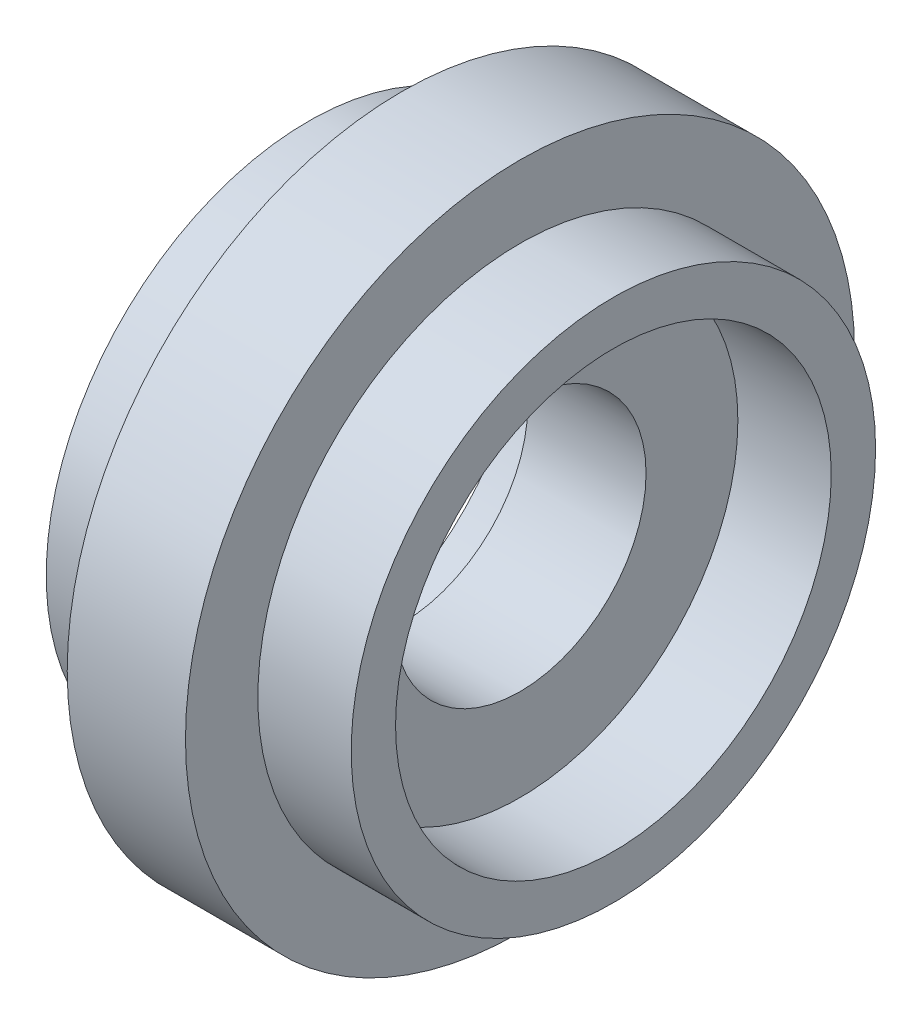
from build123d import *

# Parameters (mm, degrees)
F_8_1_8_1_DURCHMESSER_BOHRUNG1_D = 8.1


with BuildPart() as part:
    # Skizze1 → Rotation1 (revolve)
    with BuildSketch(Plane.XY):
        Polygon((0, 0), (0, 10.75), (1.9, 10.75), (1.9, 8.425), (4.9, 8.425), (4.9, 7), (1.9, 7), (1.9, 0), align=None)
    rotation1 = revolve(axis=Axis((0, 0, 0), (-1, 0, 0)))

    # Ø8.1 (8.1) Durchmesser Bohrung1 (through all)
    with Locations(Plane.ZY):
        with Locations((0, 0)):
            f_8_1_8_1_durchmesser_bohrung1 = Hole(F_8_1_8_1_DURCHMESSER_BOHRUNG1_D / 2)

    # Spiegeln1: Rotation1, Ø8.1 (8.1) Durchmesser Bohrung1 across plane
    add(rotation1.mirror(Plane(origin=(0, 0, 0), x_dir=(0, 0, 1), z_dir=(1, 0, 0))))
    add(f_8_1_8_1_durchmesser_bohrung1.mirror(Plane(origin=(0, 0, 0), x_dir=(0, 0, 1), z_dir=(1, 0, 0))), mode=Mode.SUBTRACT)


solid = part.part
